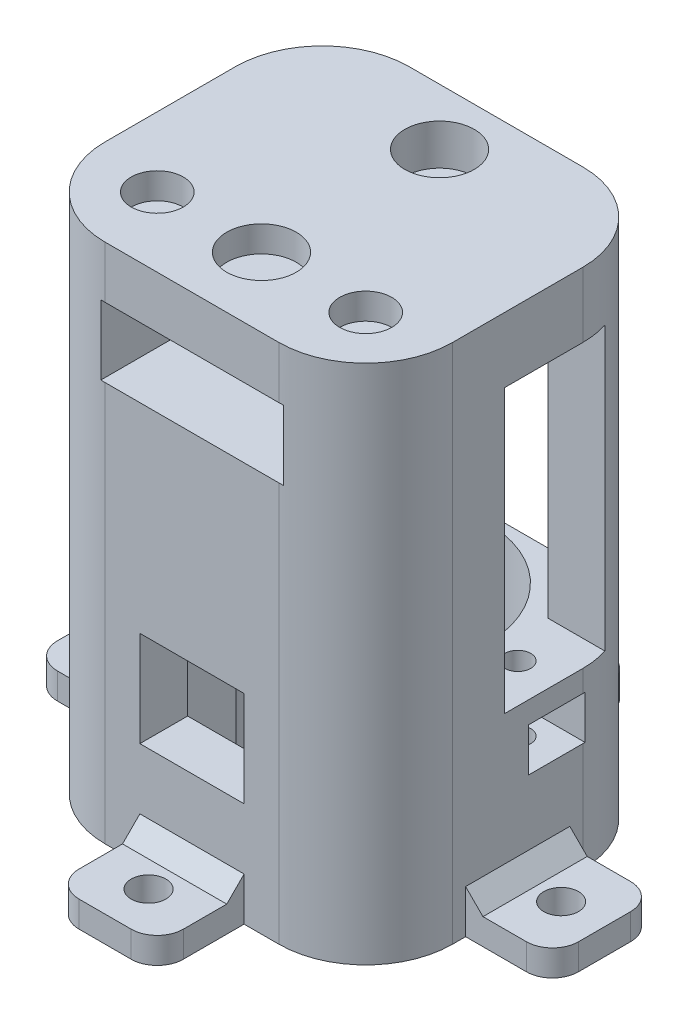
from build123d import *

# Parameters (mm, degrees)
ESBO_O2_W                                     = 40
ESBO_O2_H                                     = 35
BASE_DEPTH                                    = 20
ESBO_O3_R                                     = 12
ESBO_O3_W                                     = 17.5
ESBO_O3_H                                     = 9
FURO_DO_ENCAIXE_DO_MOTOR_DEPTH                = 57.789083458
ESBO_O5_R                                     = 1.5
FURO_DOS_PARAFUSOS_DO_MOTOR_DEPTH             = 57.789083458
ESBO_O6_W                                     = 6.5
ESBO_O6_H                                     = 5
FURO_DA_ARRUELA_PARA_PARAFUSOS_DO_MOTOR_DEPTH = 57.789083458
ESBO_O7_W                                     = 12
ESBO_O7_H                                     = 21.613382206
CALHA_PARA_OS_CABOS_DO_MOTOR_DEPTH            = 8
ESBO_O10_W                                    = 7
ESBO_O10_H                                    = 10.5
ESBO_O10_W_2                                  = 12
ESBO_O10_H_2                                  = 5.5
ESBO_O10_H_3                                  = 7
BASE_EXTENDIDA_DEPTH                          = 35
CHANFRO_DA_BASE_EXTENDIDA_REACH               = 75.068
PONTE_1_REACH                                 = 72.612
ESBO_O12_W                                    = 7
ESBO_O12_H                                    = 2.5
PONTE_2_REACH                                 = 72.612
ESBO_O13_W                                    = 7
ESBO_O13_H                                    = 2.5
ESBO_O14_W                                    = 40
ESBO_O14_H                                    = 35
TELHADO_DEPTH                                 = 5
ESBO_O18_R                                    = 4
FURO_DO_EIXO_DEPTH                            = 8
ESBO_O20_W                                    = 12
ESBO_O20_H                                    = 6
CALHA_PARA_OS_CABOS_DO_MOTOR_SUPERIOR_DEPTH   = 15
CAMA_START                                    = -0.3
ESBO_O21_R                                    = 1.5
CAMA_FURO_DO_PARAFUSO_1_DEPTH                 = 0.3
ESBO_O22_R                                    = 1.5
CAMA_FURO_DO_PARAFUSO_2_DEPTH                 = 0.3
CAMA_PARA_O_TELHADO_DEPTH                     = 0.4
ESBO_O24_R                                    = 4
CAMA_PARA_O_FURO_DO_EIXO_DEPTH                = 0.3
FILETE1_R                                     = 10
FILETE2_R                                     = 10
FILETE3_R                                     = 10
FILETE4_R                                     = 10
ESBO_O26_W                                    = 21
ESBO_O26_H                                    = 8
CORTE_EXTRUS_O1_DEPTH                         = 20
ESBO_O28_W                                    = 12
ESBO_O28_H                                    = 3
RESSALTO_EXTRUS_O11_DEPTH                     = 10
ESBO_O29_R                                    = 2
CORTE_EXTRUS_O2_DEPTH                         = 10
ESBO_O30_W                                    = 12
ESBO_O30_H                                    = 3
RESSALTO_EXTRUS_O12_DEPTH                     = 10
ESBO_O31_R                                    = 2
CORTE_EXTRUS_O3_DEPTH                         = 10
CHANFRO1_SIZE                                 = 2
CHANFRO2_SIZE                                 = 2
CHANFRO3_SIZE                                 = 2
FILETE5_R                                     = 3
FILETE6_R                                     = 3
FILETE7_R                                     = 3
FILETE8_R                                     = 3
FILETE9_R                                     = 3
FILETE10_R                                    = 3
FILETE7_OF_ESPELHAR5_R                        = 3
FILETE8_OF_ESPELHAR5_R                        = 3
CHANFRO4_SIZE                                 = 2
ESBO_O32_R                                    = 4
ESBO_O32_R_2                                  = 3
CORTE_EXTRUS_O4_DEPTH                         = 3


with BuildPart() as part:
    # Esboço2 → Base (new body)
    with BuildSketch(Plane(origin=(0, 0, 0), x_dir=(1, 0, 0), z_dir=(0, 1, 0))):
        with Locations((20, 17.5)):
            Rectangle(ESBO_O2_W, ESBO_O2_H)
    extrude(amount=BASE_DEPTH)

    # Esboço3 → Furo do encaixe do motor (cut, through all)
    with BuildSketch(Plane(origin=(0, 20, 0), x_dir=(1, 0, 0), z_dir=(0, 1, 0))):
        with Locations((20, 22)):
            Circle(ESBO_O3_R)
        with Locations((20, 10)):
            Rectangle(ESBO_O3_W, ESBO_O3_H)
    extrude(amount=-FURO_DO_ENCAIXE_DO_MOTOR_DEPTH, mode=Mode.SUBTRACT)

    # Esboço5 → Furo dos parafusos do motor (cut, through all)
    with BuildSketch(Plane(origin=(0, 20, 0), x_dir=(1, 0, 0), z_dir=(0, 1, 0))):
        with Locations(Location((4.5, 22, 0), (0, 0, 270))):
            Circle(ESBO_O5_R)
        with Locations(Location((35.5, 22, 0), (0, 0, 270))):
            Circle(ESBO_O5_R)
    extrude(amount=-FURO_DOS_PARAFUSOS_DO_MOTOR_DEPTH, mode=Mode.SUBTRACT)

    # Esboço6 → Furo da arruela para parafusos do motor (cut, through all)
    with BuildSketch(Plane(origin=(40, 0, 0), x_dir=(0, 0, -1), z_dir=(1, 0, 0))):
        with Locations((22, 15)):
            Rectangle(ESBO_O6_W, ESBO_O6_H)
    extrude(amount=-FURO_DA_ARRUELA_PARA_PARAFUSOS_DO_MOTOR_DEPTH, mode=Mode.SUBTRACT)

    # Esboço7 → Calha para os cabos do motor (cut)
    with BuildSketch(Plane(origin=(0, 20, 0), x_dir=(1, 0, 0), z_dir=(0, 1, 0))):
        with Locations((20, 7.545181244)):
            Rectangle(ESBO_O7_W, ESBO_O7_H)
    extrude(amount=-CALHA_PARA_OS_CABOS_DO_MOTOR_DEPTH, mode=Mode.SUBTRACT)

    # Esboço10 → Base extendida (add)
    with BuildSketch(Plane(origin=(0, 20, 0), x_dir=(1, 0, 0), z_dir=(0, 1, 0))):
        with Locations((3.5, 10.75)):
            Rectangle(ESBO_O10_W, ESBO_O10_H)
        Polygon((7, 5.5), (0, 5.5), (0, 0), (14, 0), (14, 5.5), (11.25, 5.5), align=None)
        Polygon((40, 0), (40, 5.5), (33, 5.5), (28.75, 5.5), (26, 5.5), (26, 0), align=None)
        with Locations((20, 2.75)):
            Rectangle(ESBO_O10_W_2, ESBO_O10_H_2)
        with Locations((36.5, 10.75)):
            Rectangle(ESBO_O10_W, ESBO_O10_H)
        with Locations((36.5, 31.5)):
            Rectangle(ESBO_O10_W, ESBO_O10_H_3)
        with Locations((3.5, 31.5)):
            Rectangle(ESBO_O10_W, ESBO_O10_H_3)
    extrude(amount=BASE_EXTENDIDA_DEPTH)

    # Esboço11 → Chanfro da base extendida (add, up to next)
    with BuildSketch(Plane(origin=(7, 0, 0), x_dir=(0, 0, -1), z_dir=(1, 0, 0)), mode=Mode.PRIVATE) as chanfro_da_base_extendida_sk1:
        Polygon((16, 55), (16, 45), (5.5, 30.004445929), (5.5, 55), align=None)
    chanfro_da_base_extendida_tool1 = extrude(chanfro_da_base_extendida_sk1.sketch, amount=CHANFRO_DA_BASE_EXTENDIDA_REACH, mode=Mode.PRIVATE) - part.part
    add(chanfro_da_base_extendida_tool1.solids().sort_by_distance((7, 45.715647, -10.000127))[0])

    # Esboço12 → Ponte 1 (add, up to next)
    with BuildSketch(Plane(origin=(0, 0, -16), x_dir=(-1, 0, 0), z_dir=(0, 0, -1)), mode=Mode.PRIVATE) as ponte_1_sk1:
        with Locations((-36.5, 53.75)):
            Rectangle(ESBO_O12_W, ESBO_O12_H)
    ponte_1_tool1 = extrude(ponte_1_sk1.sketch, amount=PONTE_1_REACH, mode=Mode.PRIVATE) - part.part
    add(ponte_1_tool1.solids().sort_by_distance((36.5, 53.75, -16))[0])

    # Esboço13 → Ponte 2 (add, up to next)
    with BuildSketch(Plane(origin=(0, 0, -16), x_dir=(-1, 0, 0), z_dir=(0, 0, -1)), mode=Mode.PRIVATE) as ponte_2_sk1:
        with Locations((-3.5, 53.75)):
            Rectangle(ESBO_O13_W, ESBO_O13_H)
    ponte_2_tool1 = extrude(ponte_2_sk1.sketch, amount=PONTE_2_REACH, mode=Mode.PRIVATE) - part.part
    add(ponte_2_tool1.solids().sort_by_distance((3.5, 53.75, -16))[0])

    # Esboço14 → Telhado (add)
    with BuildSketch(Plane(origin=(0, 55, 0), x_dir=(1, 0, 0), z_dir=(0, 1, 0))):
        with Locations((20, 17.5)):
            Rectangle(ESBO_O14_W, ESBO_O14_H)
    extrude(amount=TELHADO_DEPTH)

    # Esboço18 → Furo do Eixo (cut)
    with BuildSketch(Plane(origin=(0, 60, 0), x_dir=(1, 0, 0), z_dir=(0, 1, 0))):
        with Locations(Location((20, 28.5, 0), (0, 0, 270))):
            Circle(ESBO_O18_R)
    extrude(amount=-FURO_DO_EIXO_DEPTH, mode=Mode.SUBTRACT)

    # Esboço20 → Calha para os cabos do motor superior (cut)
    with BuildSketch(Plane(origin=(0, 0, -5.5), x_dir=(-1, 0, 0), z_dir=(0, 0, -1))):
        with Locations((-20, 20)):
            Rectangle(ESBO_O20_W, ESBO_O20_H)
    extrude(amount=-CALHA_PARA_OS_CABOS_DO_MOTOR_SUPERIOR_DEPTH, mode=Mode.SUBTRACT)

    # Esboço21 → Cama furo do parafuso 1 (add)
    with BuildSketch(Plane.XZ.offset(-17.5).offset(CAMA_START)):
        with Locations(Location((35.5, -22, 0), (0, 0, 90))):
            Circle(ESBO_O21_R)
    extrude(amount=CAMA_FURO_DO_PARAFUSO_1_DEPTH)

    # Esboço22 → Cama furo do parafuso 2 (add)
    with BuildSketch(Plane.XZ.offset(-17.5).offset(CAMA_START)):
        with Locations(Location((4.5, -22, 0), (0, 0, 90))):
            Circle(ESBO_O22_R)
    extrude(amount=CAMA_FURO_DO_PARAFUSO_2_DEPTH)

    # Esboço23 → Cama para o telhado (add)
    with BuildSketch(Plane.XZ.offset(-55)):
        Polygon((22.908140654, -16), (33, -30.471629423), (33, -16), align=None)
        Polygon((7, -16), (7, -30.471629423), (17.230691655, -16), align=None)
    extrude(amount=CAMA_PARA_O_TELHADO_DEPTH)

    # Esboço24 → Cama para o furo do eixo (add)
    with BuildSketch(Plane.XZ.offset(-55).offset(CAMA_START)):
        with Locations(Location((20, -28.5, 0), (0, 0, 90))):
            Circle(ESBO_O24_R)
    extrude(amount=CAMA_PARA_O_FURO_DO_EIXO_DEPTH)

    # Filete1
    # the kernel refuses this fillet: 10 mm, written as the material it takes off along each edge
    with BuildSketch(Plane(origin=(40, -25, -35), x_dir=(0, 0, 1), z_dir=(0, 1, 0))) as filete1_piece_1:
        with BuildLine():
            CenterArc((FILETE1_R, -FILETE1_R), FILETE1_R, 90, 90)
            Line((0, -FILETE1_R), (0, 0))
            Line((0, 0), (FILETE1_R, 0))
        make_face()
    extrude(amount=110, mode=Mode.SUBTRACT)

    # Filete2
    # the kernel refuses this fillet: 10 mm, written as the material it takes off along each edge
    with BuildSketch(Plane(origin=(0, 85, -35), x_dir=(0, 0, 1), z_dir=(0, -1, 0))) as filete2_piece_1:
        with BuildLine():
            CenterArc((FILETE2_R, -FILETE2_R), FILETE2_R, 90, 90)
            Line((0, -FILETE2_R), (0, 0))
            Line((0, 0), (FILETE2_R, 0))
        make_face()
    extrude(amount=110, mode=Mode.SUBTRACT)

    # Filete3
    filete3_edges = [part.edges().sort_by_distance(p)[0] for p in [
        (0, 30, 0),
    ]]
    fillet(filete3_edges, radius=FILETE3_R)

    # Filete4
    filete4_edges = [part.edges().sort_by_distance(p)[0] for p in [
        (40, 30, 0),
    ]]
    fillet(filete4_edges, radius=FILETE4_R)

    # Esboço26 → Corte-extrusão1 (cut)
    with BuildSketch(Plane.XY):
        with Locations((20, 50)):
            Rectangle(ESBO_O26_W, ESBO_O26_H)
    extrude(amount=-CORTE_EXTRUS_O1_DEPTH, mode=Mode.SUBTRACT)

    # Esboço28 → Ressalto-extrusão11 (add)
    with BuildSketch(Plane(origin=(40, 0, 0), x_dir=(0, 0, -1), z_dir=(1, 0, 0))):
        with Locations((17.5, 1.5)):
            Rectangle(ESBO_O28_W, ESBO_O28_H)
    ressalto_extrus_o11 = extrude(amount=RESSALTO_EXTRUS_O11_DEPTH)

    # Esboço29 → Corte-extrusão2 (cut)
    with BuildSketch(Plane(origin=(0, 3, 0), x_dir=(1, 0, 0), z_dir=(0, 1, 0))):
        with Locations(Location((45, 17.5, 0), (0, 0, 270))):
            Circle(ESBO_O29_R)
    corte_extrus_o2 = extrude(amount=-CORTE_EXTRUS_O2_DEPTH, mode=Mode.SUBTRACT)

    # Espelhar1: Ressalto-extrusão11 across plane
    add(ressalto_extrus_o11.mirror(Plane(origin=(20, 0, 0), x_dir=(0, 0, 1), z_dir=(1, 0, 0))))

    # Espelhar2: Corte-extrusão2 across plane
    add(corte_extrus_o2.mirror(Plane(origin=(20, 0, 0), x_dir=(0, 0, 1), z_dir=(1, 0, 0))), mode=Mode.SUBTRACT)

    # Esboço30 → Ressalto-extrusão12 (add)
    with BuildSketch(Plane.XY):
        with Locations((20, 1.5)):
            Rectangle(ESBO_O30_W, ESBO_O30_H)
    ressalto_extrus_o12 = extrude(amount=RESSALTO_EXTRUS_O12_DEPTH)

    # Esboço31 → Corte-extrusão3 (cut)
    with BuildSketch(Plane(origin=(0, 3, 0), x_dir=(1, 0, 0), z_dir=(0, 1, 0))):
        with Locations(Location((20, -5, 0), (0, 0, 270))):
            Circle(ESBO_O31_R)
    corte_extrus_o3 = extrude(amount=-CORTE_EXTRUS_O3_DEPTH, mode=Mode.SUBTRACT)

    # Chanfro1
    chanfro1_edges = [part.edges().sort_by_distance(p)[0] for p in [
        (40, 3, -17.5),
    ]]
    chamfer(chanfro1_edges, length=CHANFRO1_SIZE)

    # Chanfro2
    chanfro2_edges = [part.edges().sort_by_distance(p)[0] for p in [
        (0, 3, -17.5),
    ]]
    chamfer(chanfro2_edges, length=CHANFRO2_SIZE)

    # Chanfro3
    chanfro3_edges = [part.edges().sort_by_distance(p)[0] for p in [
        (20, 3, 0),
    ]]
    chamfer(chanfro3_edges, length=CHANFRO3_SIZE)

    # Filete5
    filete5_edges = [part.edges().sort_by_distance(p)[0] for p in [
        (50, 1.5, -11.5),
    ]]
    fillet(filete5_edges, radius=FILETE5_R)

    # Filete6
    filete6_edges = [part.edges().sort_by_distance(p)[0] for p in [
        (50, 1.5, -23.5),
    ]]
    fillet(filete6_edges, radius=FILETE6_R)

    # Filete7
    filete7_edges = [part.edges().sort_by_distance(p)[0] for p in [
        (26, 1.5, 10),
    ]]
    fillet(filete7_edges, radius=FILETE7_R)

    # Filete8
    filete8_edges = [part.edges().sort_by_distance(p)[0] for p in [
        (14, 1.5, 10),
    ]]
    fillet(filete8_edges, radius=FILETE8_R)

    # Filete9
    filete9_edges = [part.edges().sort_by_distance(p)[0] for p in [
        (-10, 1.5, -11.5),
    ]]
    fillet(filete9_edges, radius=FILETE9_R)

    # Filete10
    filete10_edges = [part.edges().sort_by_distance(p)[0] for p in [
        (-10, 1.5, -23.5),
    ]]
    fillet(filete10_edges, radius=FILETE10_R)

    # Espelhar5: Ressalto-extrusão12, Corte-extrusão3 across plane
    add(ressalto_extrus_o12.mirror(Plane.XY.offset(-17.5)))
    add(corte_extrus_o3.mirror(Plane.XY.offset(-17.5)), mode=Mode.SUBTRACT)

    # Filete7 of Espelhar5
    filete7_of_espelhar5_edges = [part.edges().sort_by_distance(p)[0] for p in [
        (26, 1.5, -45),
    ]]
    fillet(filete7_of_espelhar5_edges, radius=FILETE7_OF_ESPELHAR5_R)

    # Filete8 of Espelhar5
    filete8_of_espelhar5_edges = [part.edges().sort_by_distance(p)[0] for p in [
        (14, 1.5, -45),
    ]]
    fillet(filete8_of_espelhar5_edges, radius=FILETE8_OF_ESPELHAR5_R)

    # Chanfro4
    chanfro4_edges = [part.edges().sort_by_distance(p)[0] for p in [
        (20, 3, -35),
    ]]
    chamfer(chanfro4_edges, length=CHANFRO4_SIZE)

    # Esboço32 → Corte-extrusão4 (cut)
    with BuildSketch(Plane(origin=(0, 60, 0), x_dir=(1, 0, 0), z_dir=(0, 1, 0))):
        with Locations(Location((20, 8, 0), (0, 0, 270))):
            Circle(ESBO_O32_R)
        with Locations(Location((8, 8, 0), (0, 0, 270))):
            Circle(ESBO_O32_R_2)
        with Locations(Location((32, 8, 0), (0, 0, 270))):
            Circle(ESBO_O32_R_2)
    extrude(amount=-CORTE_EXTRUS_O4_DEPTH, mode=Mode.SUBTRACT)


solid = part.part
